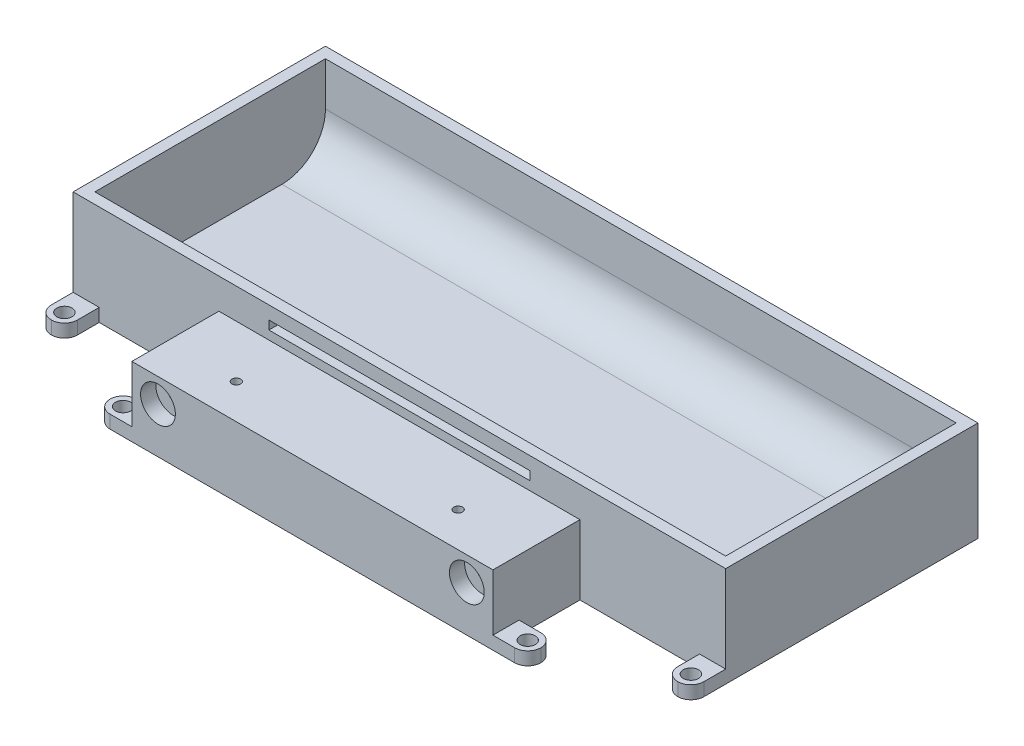
from build123d import *

# Parameters (mm, degrees)
SKETCH_1_W          = 83
SKETCH_1_H          = 20
EXTRUDE_1_DEPTH     = 16
SKETCH_2_R          = 4
CUT_EXTRUDE_1_DEPTH = 3.5
SKETCH_3_R          = 1
CUT_EXTRUDE_2_DEPTH = 10
SKETCH_6_R          = 1
CUT_EXTRUDE_5_DEPTH = 8
SKETCH_7_W          = 150
SKETCH_7_H          = 3
EXTRUDE_2_DEPTH     = 58
SKETCH_8_W          = 150
SKETCH_8_H          = 58
SKETCH_8_W_2        = 145
SKETCH_8_H_2        = 53
EXTRUDE_3_DEPTH     = 20
FILLET_1_R          = 10
CUT_EXTRUDE_START   = -45
SKETCH_9_W          = 2
SKETCH_9_H          = 2
CUT_EXTRUDE_6_DEPTH = 60
SKETCH_10_W         = 6
SKETCH_10_H         = 3
EXTRUDE_4_DEPTH     = 8
SKETCH_11_W         = 6
SKETCH_11_H         = 3
EXTRUDE_5_DEPTH     = 8
SKETCH_12_W         = 6
SKETCH_12_H         = 3
EXTRUDE_6_DEPTH     = 8
SKETCH_13_W         = 6
SKETCH_13_H         = 3
EXTRUDE_7_DEPTH     = 8
FILLET_2_R          = 3
SKETCH_14_R         = 1.75
CUT_EXTRUDE_7_DEPTH = 109.632407688


with BuildPart() as part:
    # 스케치1 → 보스-돌출1 (new body)
    with BuildSketch(Plane(origin=(0, 0, 0), x_dir=(1, 0, 0), z_dir=(0, 1, 0))):
        Rectangle(SKETCH_1_W, SKETCH_1_H)
    extrude(amount=EXTRUDE_1_DEPTH)

    # 스케치2 → 컷-돌출1 (cut)
    with BuildSketch(Plane.XY.offset(10)):
        with Locations((-35.5, 10.5)):
            Circle(SKETCH_2_R)
        with Locations((35.5, 10.5)):
            Circle(SKETCH_2_R)
    extrude(amount=-CUT_EXTRUDE_1_DEPTH, mode=Mode.SUBTRACT)

    # 스케치3 → 컷-돌출2 (cut)
    with BuildSketch(Plane(origin=(0, 16, 0), x_dir=(1, 0, 0), z_dir=(0, 1, 0))):
        with Locations(Location((-25.5, -2, 0), (0, 0, 270))):
            Circle(SKETCH_3_R)
        with Locations(Location((25.5, -2, 0), (0, 0, 270))):
            Circle(SKETCH_3_R)
    extrude(amount=-CUT_EXTRUDE_2_DEPTH, mode=Mode.SUBTRACT)

    # 스케치6 → 컷-돌출5 (cut)
    with BuildSketch(Plane.XY.offset(6.5)):
        with Locations((-35.5, 10.5)):
            Circle(SKETCH_6_R)
        with Locations((35.5, 10.5)):
            Circle(SKETCH_6_R)
    extrude(amount=-CUT_EXTRUDE_5_DEPTH, mode=Mode.SUBTRACT)

    # 스케치7 → 보스-돌출2 (add)
    with BuildSketch(Plane(origin=(0, 0, -10), x_dir=(-1, 0, 0), z_dir=(0, 0, -1))):
        with Locations((0, 1.5)):
            Rectangle(SKETCH_7_W, SKETCH_7_H)
    extrude(amount=EXTRUDE_2_DEPTH)

    # 스케치8 → 보스-돌출3 (add)
    with BuildSketch(Plane(origin=(0, 3, 0), x_dir=(1, 0, 0), z_dir=(0, 1, 0))):
        with Locations((0, 39)):
            Rectangle(SKETCH_8_W, SKETCH_8_H)
        with Locations((0, 39)):
            Rectangle(SKETCH_8_W_2, SKETCH_8_H_2, mode=Mode.SUBTRACT)
    extrude(amount=EXTRUDE_3_DEPTH)

    # 필렛1
    fillet_1_edges = [part.edges().sort_by_distance(p)[0] for p in [
        (0, 3, -65.5),
        (0, 3, -12.5),
    ]]
    fillet(fillet_1_edges, radius=FILLET_1_R)

    # 스케치9 → 컷-돌출6 (cut)
    with BuildSketch(Plane.ZY.offset(75).offset(CUT_EXTRUDE_START)):
        with Locations((-67, 19)):
            Rectangle(SKETCH_9_W, SKETCH_9_H)
        with Locations((-11, 19)):
            Rectangle(SKETCH_9_W, SKETCH_9_H)
    extrude(amount=-CUT_EXTRUDE_6_DEPTH, mode=Mode.SUBTRACT)

    # 스케치10 → 보스-돌출4 (add)
    with BuildSketch(Plane.XY.offset(-10)):
        with Locations((-72, 1.5)):
            Rectangle(SKETCH_10_W, SKETCH_10_H)
        with Locations((72, 1.5)):
            Rectangle(SKETCH_10_W, SKETCH_10_H)
    extrude(amount=EXTRUDE_4_DEPTH)

    # 스케치11 → 보스-돌출5 (add)
    with BuildSketch(Plane(origin=(0, 0, -68), x_dir=(-1, 0, 0), z_dir=(0, 0, -1))):
        with Locations((-33, 1.5)):
            Rectangle(SKETCH_11_W, SKETCH_11_H)
        with Locations((33, 1.5)):
            Rectangle(SKETCH_11_W, SKETCH_11_H)
    extrude(amount=EXTRUDE_5_DEPTH)

    # 스케치12 → 보스-돌출6 (add)
    with BuildSketch(Plane.ZY.offset(41.5)):
        with Locations((7, 1.5)):
            Rectangle(SKETCH_12_W, SKETCH_12_H)
    extrude(amount=EXTRUDE_6_DEPTH)

    # 스케치13 → 보스-돌출7 (add)
    with BuildSketch(Plane(origin=(41.5, 0, 0), x_dir=(0, 0, -1), z_dir=(1, 0, 0))):
        with Locations((-7, 1.5)):
            Rectangle(SKETCH_13_W, SKETCH_13_H)
    extrude(amount=EXTRUDE_7_DEPTH)

    # 필렛2
    fillet_2_edges = [part.edges().sort_by_distance(p)[0] for p in [
        (69, 1.5, -2),
        (75, 1.5, -2),
        (-75, 1.5, -2),
        (-69, 1.5, -2),
        (-36, 1.5, -76),
        (-30, 1.5, -76),
        (30, 1.5, -76),
        (36, 1.5, -76),
        (-49.5, 1.5, 4),
        (-49.5, 1.5, 10),
        (49.5, 1.5, 10),
        (49.5, 1.5, 4),
    ]]
    fillet(fillet_2_edges, radius=FILLET_2_R - 0.0001)  # a hair under: the kernel refuses the full size

    # 스케치14 → 컷-돌출7 (cut, through all)
    with BuildSketch(Plane(origin=(0, 3, 0), x_dir=(1, 0, 0), z_dir=(0, 1, 0))):
        with Locations(Location((-33, 73, 0), (0, 0, 270))):
            Circle(SKETCH_14_R)
        with Locations(Location((33, 73, 0), (0, 0, 270))):
            Circle(SKETCH_14_R)
        with Locations(Location((-46.5, -7, 0), (0, 0, 270))):
            Circle(SKETCH_14_R)
        with Locations(Location((46.5, -7, 0), (0, 0, 270))):
            Circle(SKETCH_14_R)
        with Locations(Location((72, 5, 0), (0, 0, 270))):
            Circle(SKETCH_14_R)
        with Locations(Location((-72, 5, 0), (0, 0, 270))):
            Circle(SKETCH_14_R)
    extrude(amount=-CUT_EXTRUDE_7_DEPTH, mode=Mode.SUBTRACT)


solid = part.part
